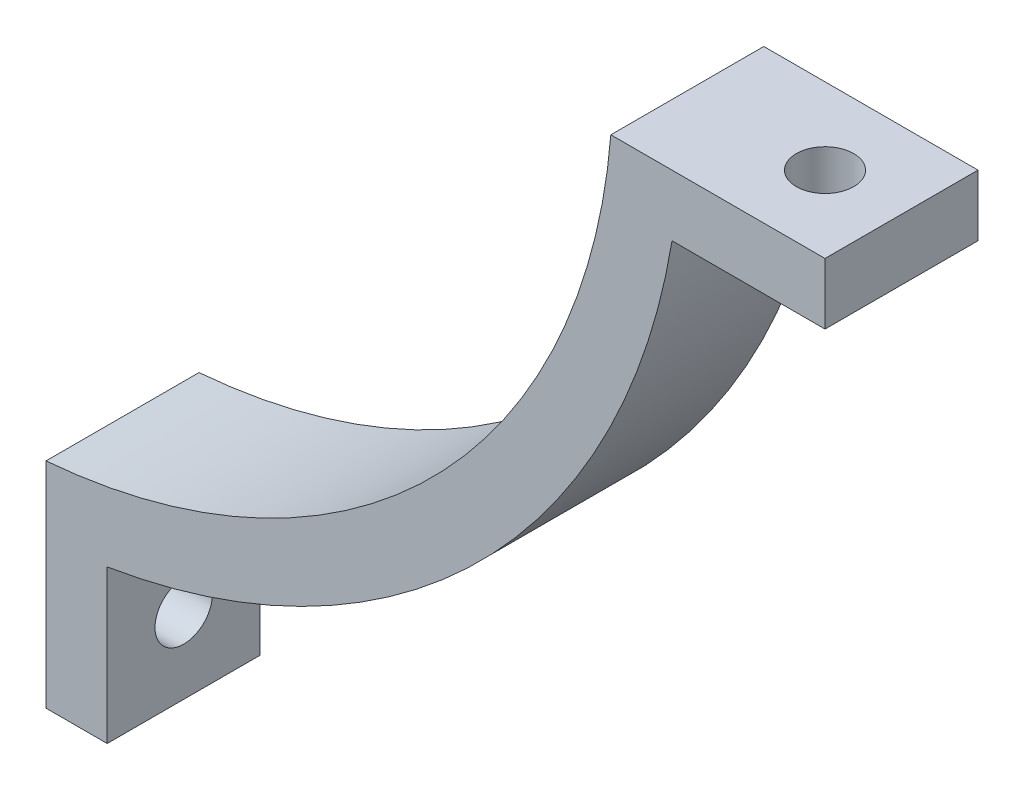
from build123d import *

# Parameters (mm, degrees)
BOSS_EXTRUDE3_DEPTH = 12.7
SKETCH2_R           = 2.38125
CUT_EXTRUDE1_DEPTH  = 5.08
SKETCH3_R           = 2.38125
CUT_EXTRUDE2_DEPTH  = 5.08


with BuildPart() as part:
    # Sketch1 → Boss-Extrude3 (new body)
    with BuildSketch(Plane.XY):
        with BuildLine():
            Line((51.079545977, -4.191), (68.859545977, -4.191))
            Line((68.859545977, -4.191), (68.859545977, -9.271))
            Line((68.859545977, -9.271), (56.159545977, -9.271))
            ThreePointArc((56.159545977, -9.271), (40.248267325, -40.248267325), (9.271, -56.159545977))
            Line((9.271, -56.159545977), (9.271, -68.859545977))
            Line((9.271, -68.859545977), (4.191, -68.859545977))
            Line((4.191, -68.859545977), (4.191, -51.079545977))
            ThreePointArc((4.191, -51.079545977), (36.240064143, -36.240064143), (51.079545977, -4.191))
        make_face()
    extrude(amount=BOSS_EXTRUDE3_DEPTH)

    # Sketch2 → Cut-Extrude1 (cut)
    with BuildSketch(Plane(origin=(9.271, 0, 0), x_dir=(0, 0, -1), z_dir=(1, 0, 0))):
        with Locations((-6.35, -62.509545977)):
            Circle(SKETCH2_R)
    extrude(amount=-CUT_EXTRUDE1_DEPTH, mode=Mode.SUBTRACT)

    # Sketch3 → Cut-Extrude2 (cut)
    with BuildSketch(Plane.XZ.offset(9.271)):
        with Locations((62.509545977, 6.35)):
            Circle(SKETCH3_R)
    extrude(amount=-CUT_EXTRUDE2_DEPTH, mode=Mode.SUBTRACT)


solid = part.part
